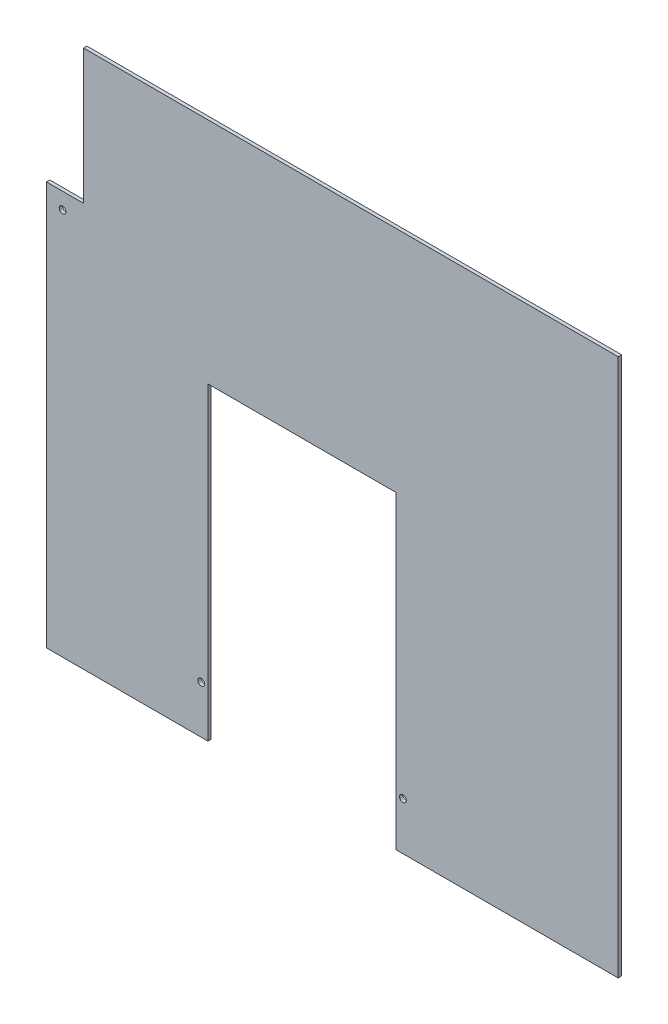
from build123d import *

# Parameters (mm, degrees)
SKETCH1_W           = 539.75
SKETCH1_H           = 508
BOSS_EXTRUDE1_DEPTH = 3.175
SKETCH2_R           = 3.175
SKETCH2_W           = 177.8
SKETCH2_H           = 292.1
CUT_EXTRUDE1_DEPTH  = 44.45
SKETCH3_W           = 34.925
SKETCH3_H           = 127
CUT_EXTRUDE2_DEPTH  = 742.218013222


with BuildPart() as part:
    # Sketch1 → Boss-Extrude1 (new body)
    with BuildSketch(Plane.XY):
        with Locations((269.875, 254)):
            Rectangle(SKETCH1_W, SKETCH1_H)
    extrude(amount=BOSS_EXTRUDE1_DEPTH)

    # Sketch2 → Cut-Extrude1 (cut)
    with BuildSketch(Plane(origin=(0, 0, 0), x_dir=(-1, 0, 0), z_dir=(0, 0, -1))):
        with Locations((-336.55, 45.085)):
            Circle(SKETCH2_R)
        with Locations((-146.05, 45.085)):
            Circle(SKETCH2_R)
        with Locations((-15.24, 365.76)):
            Circle(SKETCH2_R)
        with Locations((-241.3, 146.05)):
            Rectangle(SKETCH2_W, SKETCH2_H)
    extrude(amount=-CUT_EXTRUDE1_DEPTH, mode=Mode.SUBTRACT)

    # Sketch3 → Cut-Extrude2 (cut, through all)
    with BuildSketch(Plane(origin=(0, 0, 0), x_dir=(-1, 0, 0), z_dir=(0, 0, -1))):
        with Locations((-17.4625, 444.5)):
            Rectangle(SKETCH3_W, SKETCH3_H)
    extrude(amount=-CUT_EXTRUDE2_DEPTH, mode=Mode.SUBTRACT)


solid = part.part
